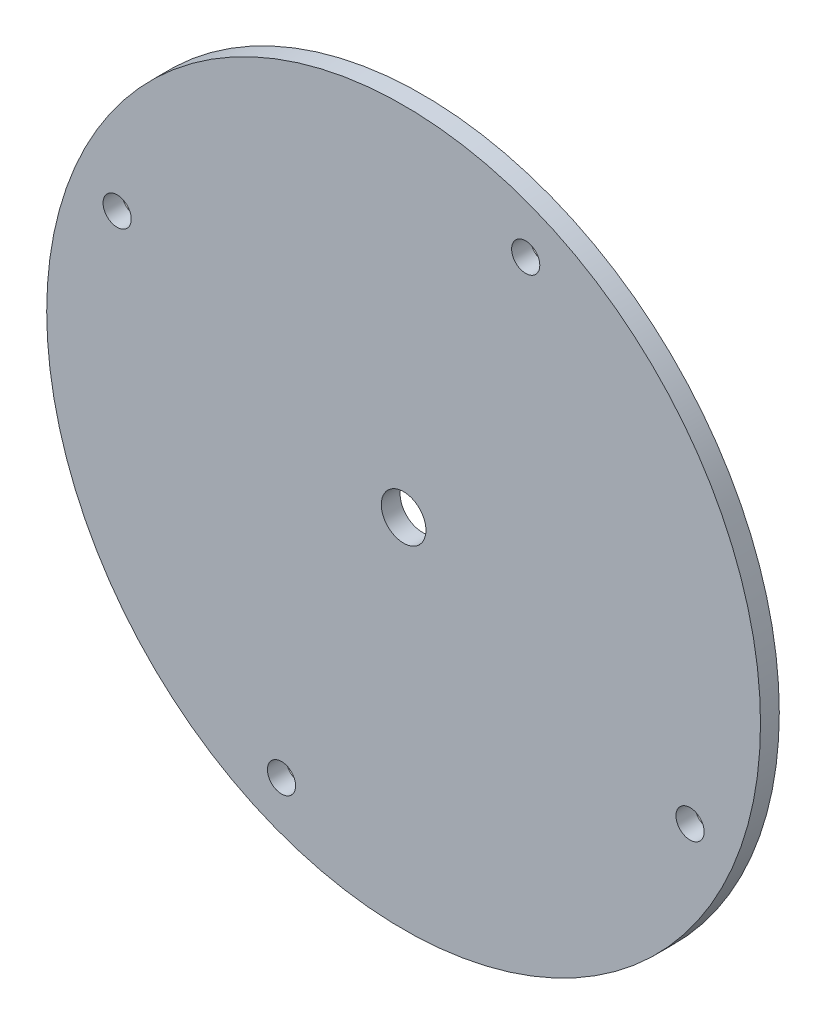
from build123d import *

# Parameters (mm, degrees)
SKETCH1_R           = 76
SKETCH1_R_2         = 3
BOSS_EXTRUDE3_DEPTH = 4
SKETCH2_R           = 4.75
CUT_EXTRUDE1_DEPTH  = 108.554637278


with BuildPart() as part:
    # Sketch1 → Boss-Extrude3 (new body)
    with BuildSketch(Plane.XY):
        Circle(SKETCH1_R)
        with Locations((26, 61)):
            Circle(SKETCH1_R_2, mode=Mode.SUBTRACT)
        with Locations((-26, -61)):
            Circle(SKETCH1_R_2, mode=Mode.SUBTRACT)
        with Locations((61, -26)):
            Circle(SKETCH1_R_2, mode=Mode.SUBTRACT)
        with Locations((-61, 26)):
            Circle(SKETCH1_R_2, mode=Mode.SUBTRACT)
    extrude(amount=BOSS_EXTRUDE3_DEPTH)

    # Sketch2 → Cut-Extrude1 (cut, through all)
    with BuildSketch(Plane.XY.offset(4)):
        Circle(SKETCH2_R)
    extrude(amount=-CUT_EXTRUDE1_DEPTH, mode=Mode.SUBTRACT)


solid = part.part
